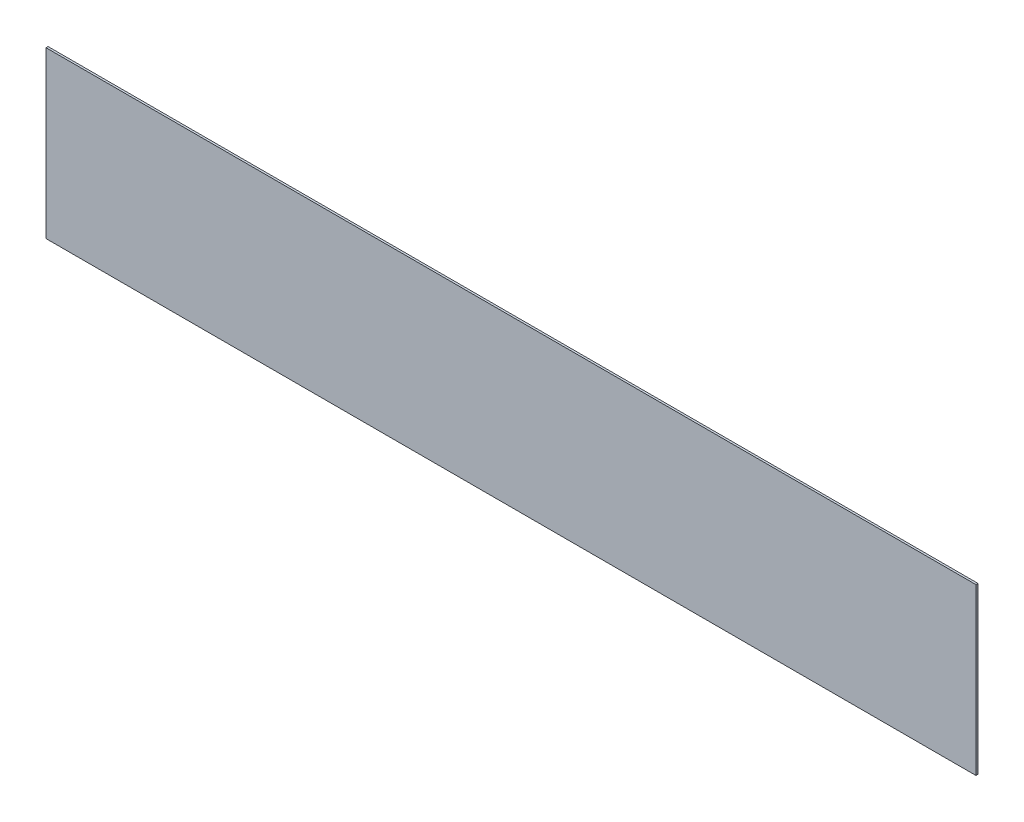
from build123d import *

# Parameters (mm, degrees)
SKETCH1_W           = 450
SKETCH1_H           = 80
BOSS_EXTRUDE1_DEPTH = 1


with BuildPart() as part:
    # Sketch1 → Boss-Extrude1 (new body)
    with BuildSketch(Plane.XY):
        Rectangle(SKETCH1_W, SKETCH1_H)
    extrude(amount=BOSS_EXTRUDE1_DEPTH)


solid = part.part
